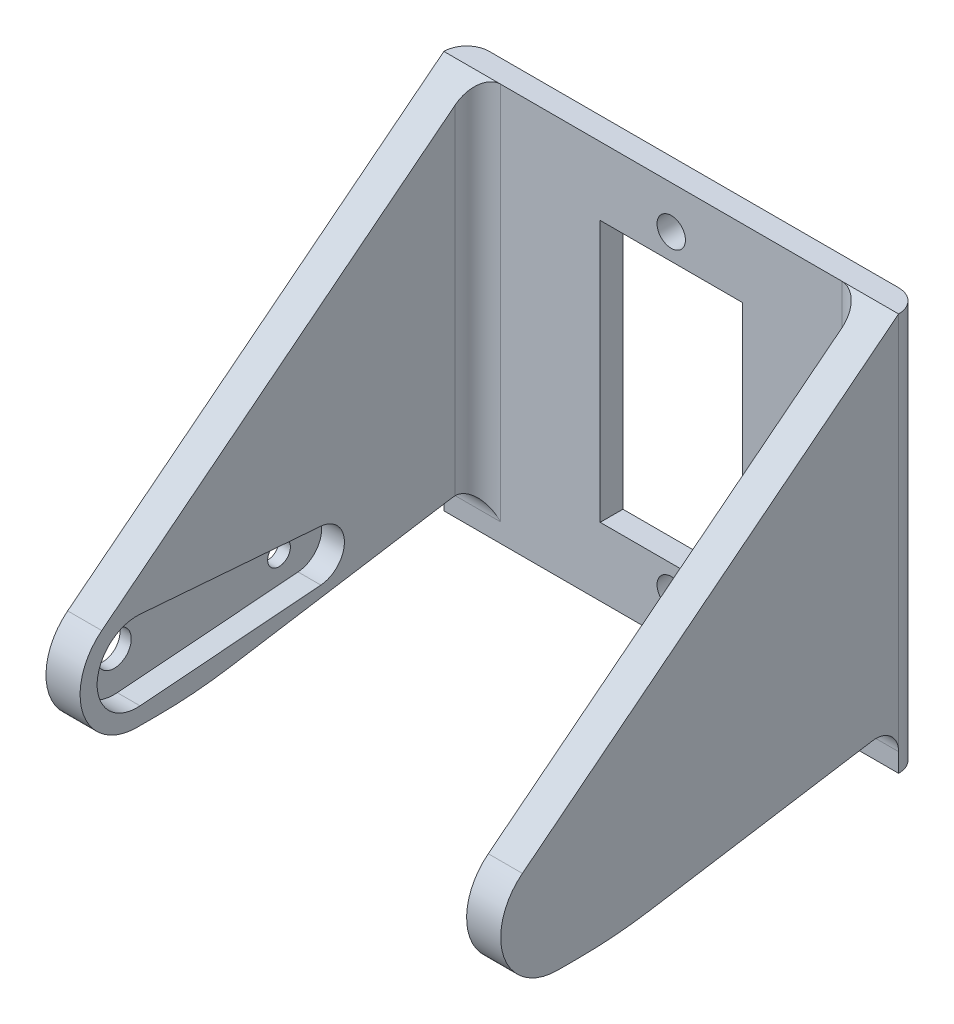
from build123d import *

# Parameters (mm, degrees)
SKETCH_1_W          = 40
SKETCH_1_H          = 35
SKETCH_1_R          = 1.25
SKETCH_1_W_2        = 12.5
SKETCH_1_H_2        = 23
EXTRUDE_1_DEPTH     = 2
EXTRUDE_2_DEPTH     = 3
CUT_EXTRUDE_1_DEPTH = 2
SKETCH_4_R          = 2.5
EXTRUDE_3_DEPTH     = 1.5
CUT_EXTRUDE_2_DEPTH = 58.22979993
FILLET_1_R          = 40
SKETCH_6_R          = 1.5
CUT_EXTRUDE_3_DEPTH = 10
SKETCH_7_R          = 1
CUT_EXTRUDE_4_DEPTH = 10
FILLET_2_R          = 2


with BuildPart() as part:
    # 草图1 → 凸台-拉伸1 (new body)
    with BuildSketch(Plane.XY):
        Rectangle(SKETCH_1_W, SKETCH_1_H)
        with Locations((0, 13.75)):
            Circle(SKETCH_1_R, mode=Mode.SUBTRACT)
        with Locations((0, -13.75)):
            Circle(SKETCH_1_R, mode=Mode.SUBTRACT)
        Rectangle(SKETCH_1_W_2, SKETCH_1_H_2, mode=Mode.SUBTRACT)
    extrude(amount=EXTRUDE_1_DEPTH)

    # 草图2 → 凸台-拉伸2 (add)
    with BuildSketch(Plane.ZY.offset(20)):
        with BuildLine():
            Line((2, -17.5), (32, -17.5))
            ThreePointArc((32, -17.5), (36.724288943, -14.13740465), (35.094229072, -8.572437595))
            Line((35.094229072, -8.572437595), (2, 17.5))
            Line((2, 17.5), (2, -17.5))
        make_face()
    extrude_2 = extrude(amount=-EXTRUDE_2_DEPTH)

    # 草图3 → 切除-拉伸1 (cut)
    with BuildSketch(Plane(origin=(-17, 0, 0), x_dir=(0, 0, -1), z_dir=(1, 0, 0))):
        with BuildLine():
            Line((-15.82421875, -10.256876965), (-31.7265625, -9.0106975))
            ThreePointArc((-31.7265625, -9.0106975), (-35.5, -12.5), (-31.7265625, -15.9893025))
            Line((-31.7265625, -15.9893025), (-15.82421875, -14.743123035))
            ThreePointArc((-15.82421875, -14.743123035), (-13.75, -12.5), (-15.82421875, -10.256876965))
        make_face()
    extrude(amount=-CUT_EXTRUDE_1_DEPTH, mode=Mode.SUBTRACT)

    # 镜向3: 凸台-拉伸2 across plane
    add(extrude_2.mirror(Plane(origin=(0, 0, 0), x_dir=(0, 0, 1), z_dir=(1, 0, 0))))

    # 草图4 → 凸台-拉伸3 (add)
    with BuildSketch(Plane.ZY.offset(-17)):
        with Locations((32, -12.5)):
            Circle(SKETCH_4_R)
    extrude(amount=EXTRUDE_3_DEPTH)

    # 草图5 → 切除-拉伸2 (cut, through all)
    with BuildSketch(Plane(origin=(20, 0, 0), x_dir=(0, 0, -1), z_dir=(1, 0, 0))):
        Polygon((-2, -17.5), (-2, -13.5), (-27, -17.5), align=None)
    extrude(amount=-CUT_EXTRUDE_2_DEPTH, mode=Mode.SUBTRACT)

    # 圆角1
    fillet_1_edges = [part.edges().sort_by_distance(p)[0] for p in [
        (-18.5, -17.5, 27),
        (18.5, -17.5, 27),
    ]]
    fillet(fillet_1_edges, radius=FILLET_1_R)

    # 草图6 → 切除-拉伸3 (cut)
    with BuildSketch(Plane(origin=(-19, 0, 0), x_dir=(0, 0, -1), z_dir=(1, 0, 0))):
        with Locations((-32, -12.5)):
            Circle(SKETCH_6_R)
    extrude(amount=-CUT_EXTRUDE_3_DEPTH, mode=Mode.SUBTRACT)

    # 草图7 → 切除-拉伸4 (cut)
    with BuildSketch(Plane(origin=(-19, 0, 0), x_dir=(0, 0, -1), z_dir=(1, 0, 0))):
        with Locations((-17.5, -12.5)):
            Circle(SKETCH_7_R)
    extrude(amount=-CUT_EXTRUDE_4_DEPTH, mode=Mode.SUBTRACT)

    # 圆角2
    fillet_2_edges = [part.edges().sort_by_distance(p)[0] for p in [
        (17, 2, 2),
        (-17, 2, 2),
        (20, 0, 0),
        (-20, 0, 0),
        (18.5, -13.5, 2),
        (-18.5, -13.5, 2),
    ]]
    fillet(fillet_2_edges, radius=FILLET_2_R - 0.0001)  # a hair under: the kernel refuses the full size


solid = part.part
